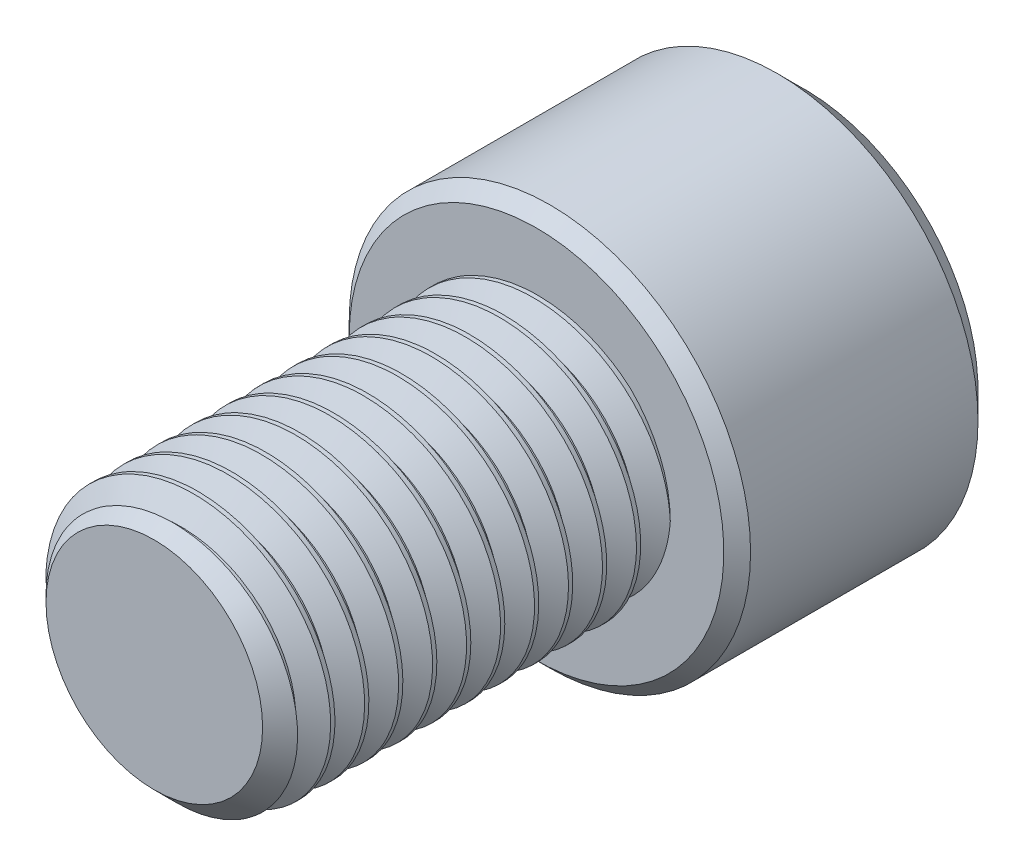
from build123d import *

# Parameters (mm, degrees)
SKETCH1_R          = 11.1125
EXTRUDE1_DEPTH     = 31.75
CHAMFER3_SIZE      = 2.116666667
CUT_SWEEP1_PITCH   = 2.822222222
SKETCH6_R          = 16.66875
EXTRUDE2_DEPTH     = 22.225
CUT_EXTRUDE1_DEPTH = 14.2875
SKETCH8_R          = 10.998522628
CUT_EXTRUDE2_DEPTH = 2.2225
CUT_EXTRUDE2_DRAFT = -45
CHAMFER1_SIZE      = 2.2225
CHAMFER2_SIZE      = 1.11125


with BuildPart() as part:
    # Sketch1 → Extrude1 (new body)
    with BuildSketch(Plane.XY):
        Circle(SKETCH1_R)
    extrude(amount=-EXTRUDE1_DEPTH)

    # Chamfer3
    chamfer3_edges = [part.edges().sort_by_distance(p)[0] for p in [
        (-11.1125, 0, 0),
    ]]
    chamfer(chamfer3_edges, length=CHAMFER3_SIZE)

    # Cut-Sweep1: the profile of Sketch3 profile screwed along a right-hand helix of 12.25 turns, 6 arcs to a turn; built about Z, then put on its axis
    cut_sweep1_z = Axis((0, 0, 0), (0, 0, 1))
    cut_sweep1_corners = [(11.1128, 0, -2.46961765), (9.279412895, 0, -1.411111111), (9.279412895, 0, -1.058333333), (11.1128, 0, 0.000173205)]
    with BuildLine(mode=Mode.PRIVATE) as cut_sweep1_profile:
        Line(cut_sweep1_corners[0], cut_sweep1_corners[1])
        Line(cut_sweep1_corners[1], cut_sweep1_corners[2])
        Line(cut_sweep1_corners[2], cut_sweep1_corners[3])
        Line(cut_sweep1_corners[3], cut_sweep1_corners[0])
    cut_sweep1_cap = Face(cut_sweep1_profile.wire())
    cut_sweep1_turn_angles = [0, 30, 60, 90, 120, 150, 180, 210, 240, 270, 300, 330, 360]
    cut_sweep1_turn_weights = [1, 0.8660254037844387, 1, 0.8660254037844387, 1, 0.8660254037844387, 1, 0.8660254037844387, 1, 0.8660254037844387, 1, 0.8660254037844387, 1]
    cut_sweep1_turn_rails = [Edge.make_bspline([Vector(p[0], p[1], 0).rotate(cut_sweep1_z, cut_sweep1_turn_angles[k]) / cut_sweep1_turn_weights[k] + Vector(0, 0, p[2] + CUT_SWEEP1_PITCH * cut_sweep1_turn_angles[k] / 360) for k in range(13)], [0, 0, 0, 1, 1, 2, 2, 3, 3, 4, 4, 5, 5, 6, 6, 6], 2, cut_sweep1_turn_weights) for p in cut_sweep1_corners]
    cut_sweep1_turn_sides = [Face.make_surface_from_curves(cut_sweep1_turn_rails[p[0]], cut_sweep1_turn_rails[p[1]]) for p in [(0, 1), (1, 2), (2, 3), (3, 0)]]
    cut_sweep1_last_angles = [4320, 4350, 4380, 4395, 4410]
    cut_sweep1_last_weights = [1, 0.8660254037844387, 1, 0.9659258262890169, 1]
    cut_sweep1_last_rails = [Edge.make_bspline([Vector(p[0], p[1], 0).rotate(cut_sweep1_z, cut_sweep1_last_angles[k]) / cut_sweep1_last_weights[k] + Vector(0, 0, p[2] + CUT_SWEEP1_PITCH * cut_sweep1_last_angles[k] / 360) for k in range(5)], [0, 0, 0, 1, 1, 2, 2, 2], 2, cut_sweep1_last_weights) for p in cut_sweep1_corners]
    cut_sweep1_last_sides = [Face.make_surface_from_curves(cut_sweep1_last_rails[p[0]], cut_sweep1_last_rails[p[1]]) for p in [(0, 1), (1, 2), (2, 3), (3, 0)]]
    cut_sweep1 = Plane(origin=(0, 0, 0), x_dir=(0, 1, 0), z_dir=(0, 0, -1)) * Solid(Shell([*[p.moved(Location((0, 0, CUT_SWEEP1_PITCH * i))) for i in range(12) for p in cut_sweep1_turn_sides], *cut_sweep1_last_sides, cut_sweep1_cap, cut_sweep1_cap.rotate(cut_sweep1_z, 4410).moved(Location((0, 0, CUT_SWEEP1_PITCH * 4410 / 360)))]))
    add(cut_sweep1, mode=Mode.SUBTRACT)

    # Sketch6 → Extrude2 (add)
    with BuildSketch(Plane(origin=(0, 0, -31.75), x_dir=(-1, 0, 0), z_dir=(0, 0, -1))):
        Circle(SKETCH6_R)
    extrude(amount=EXTRUDE2_DEPTH)

    # Sketch7 → Cut-Extrude1 (cut)
    with BuildSketch(Plane(origin=(0, 0, -53.975), x_dir=(-1, 0, 0), z_dir=(0, 0, -1))):
        Polygon((0, 10.998522628), (-9.525, 5.499261314), (-9.525, -5.499261314), (0, -10.998522628), (9.525, -5.499261314), (9.525, 5.499261314), align=None)
    extrude(amount=-CUT_EXTRUDE1_DEPTH, mode=Mode.SUBTRACT)


with BuildPart() as cut_extrude2_tool:
    # Sketch8 → Cut-Extrude2 (with draft: the straight prism first)
    with BuildSketch(Plane(origin=(0, 0, -53.975), x_dir=(-1, 0, 0), z_dir=(0, 0, -1))):
        Circle(SKETCH8_R)
    extrude(amount=-CUT_EXTRUDE2_DEPTH)
    # Cut-Extrude2: the draft: its side faces are tilted about the plane it starts from
    cut_extrude2_sides = [cut_extrude2_tool.faces().sort_by_distance(p)[0] for p in [
        (10.998522628, 0, -52.86375),
    ]]
    draft(cut_extrude2_sides, Plane(origin=(0, 0, -53.975), x_dir=(-1, 0, 0), z_dir=(0, 0, -1)), CUT_EXTRUDE2_DRAFT)


with BuildPart() as part_1:
    add(part.part)

    # Cut-Extrude2: cut by cut_extrude2_tool
    add(cut_extrude2_tool.part, mode=Mode.SUBTRACT)

    # Chamfer1
    chamfer1_edges = [part_1.edges().sort_by_distance(p)[0] for p in [
        (16.66875, 0, -53.975),
    ]]
    chamfer(chamfer1_edges, length=CHAMFER1_SIZE)

    # Chamfer2
    chamfer2_edges = [part_1.edges().sort_by_distance(p)[0] for p in [
        (16.66875, 0, -31.75),
    ]]
    chamfer(chamfer2_edges, length=CHAMFER2_SIZE)


solid = part_1.part
